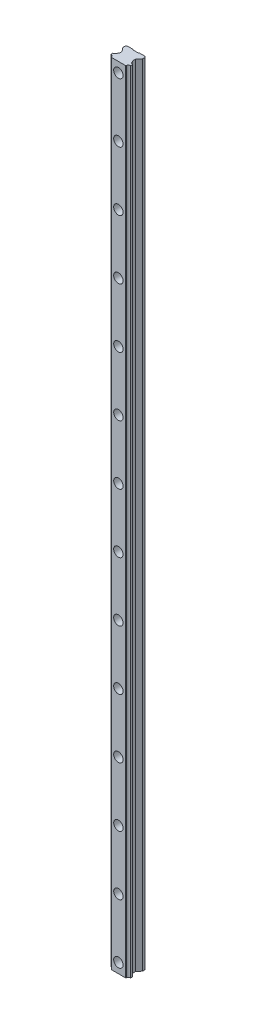
from build123d import *

# Parameters (mm, degrees)
SKIZZE1_W                       = 20
SKIZZE1_H                       = 800
AUFSATZ_LINEAR_AUSTRAGEN1_DEPTH = 18
SKIZZE2_W                       = 5
SKIZZE2_H                       = 0.5
SCHNITT_LINEAR_AUSTRAGEN1_DEPTH = 801.264956124
SCHNITT_LINEAR_AUSTRAGEN2_DEPTH = 801.264956124
SCHNITT_LINEAR_AUSTRAGEN3_DEPTH = 801.264956124
FORMSCHR_GE1_ANGLE              = 50.906141114
FORMSCHR_GE2_ANGLE              = 50.906141114
FORMSCHR_GE3_ANGLE              = 45
F_5_0_5_DURCHMESSER_BOHRUNG1_D  = 5
F_5_0_5_DURCHMESSER_BOHRUNG2_D  = 5
BOHRUNG1_D                      = 6
BOHRUNG1_DEPTH                  = 18
BOHRUNG1_CBORE_D                = 9.5
BOHRUNG1_CBORE_DEPTH            = 8.5
FASE1_SIZE                      = 1
FASE2_SIZE                      = 0.448979592


with BuildPart() as part:
    # Skizze1 → Aufsatz-Linear austragen1 (new body)
    with BuildSketch(Plane(origin=(0, 0, 0), x_dir=(-1, 0, 0), z_dir=(0, 0, -1))):
        with Locations((0, 400)):
            Rectangle(SKIZZE1_W, SKIZZE1_H)
    extrude(amount=-AUFSATZ_LINEAR_AUSTRAGEN1_DEPTH)

    # Skizze2 → Schnitt-Linear austragen1 (cut, through all)
    with BuildSketch(Plane.XZ):
        with Locations((0, 0.25)):
            Rectangle(SKIZZE2_W, SKIZZE2_H)
    extrude(amount=-SCHNITT_LINEAR_AUSTRAGEN1_DEPTH, mode=Mode.SUBTRACT)

    # Skizze3 → Schnitt-Linear austragen2 (cut, through all)
    with BuildSketch(Plane.XZ):
        with BuildLine():
            Line((-10, 13.5), (-10, 7.5))
            Line((-10, 7.5), (-6.75, 7.5))
            Line((-6.75, 7.5), (-6.75, 10.5))
            Line((-6.75, 10.5), (-7.5, 11.109375))
            ThreePointArc((-7.5, 11.109375), (-8.270470592, 12.806156162), (-10, 13.5))
        make_face()
    extrude(amount=-SCHNITT_LINEAR_AUSTRAGEN2_DEPTH, mode=Mode.SUBTRACT)

    # Skizze4 → Schnitt-Linear austragen3 (cut, through all)
    with BuildSketch(Plane.XZ):
        with BuildLine():
            Line((7.5, 11.109375), (6.75, 10.5))
            Line((6.75, 10.5), (6.75, 3.5))
            Line((6.75, 3.5), (10, 3.5))
            Line((10, 3.5), (10, 13.5))
            ThreePointArc((10, 13.5), (8.270470592, 12.806156162), (7.5, 11.109375))
        make_face()
    extrude(amount=-SCHNITT_LINEAR_AUSTRAGEN3_DEPTH, mode=Mode.SUBTRACT)

    # Formschräge1
    formschr_ge1_faces = [part.faces().sort_by_distance(p)[0] for p in [
        (8.375, 400, 3.5),
    ]]
    draft(formschr_ge1_faces, Plane(origin=(10, 800, 18), x_dir=(0, 0, 1), z_dir=(1, 0, 0)), FORMSCHR_GE1_ANGLE)

    # Formschräge2
    formschr_ge2_faces = [part.faces().sort_by_distance(p)[0] for p in [
        (-8.375, 400, 7.5),
    ]]
    draft(formschr_ge2_faces, Plane(origin=(-6.75, 800, 7.5), x_dir=(0, 0, -1), z_dir=(-1, 0, 0)), FORMSCHR_GE2_ANGLE)

    # Formschräge3
    formschr_ge3_faces = [part.faces().sort_by_distance(p)[0] for p in [
        (2.5, 400, 0.25),
        (-2.5, 400, 0.25),
    ]]
    draft(formschr_ge3_faces, Plane(origin=(2.5, 800, 0.5), x_dir=(-1, 0, 0), z_dir=(0, 0, -1)), FORMSCHR_GE3_ANGLE)

    # Ø5.0 (5) Durchmesser Bohrung1 (through all)
    with Locations(Plane(origin=(0, 800, 0), x_dir=(1, 0, 0), z_dir=(0, 1, 0))):
        with Locations((10, -18)):
            Hole(F_5_0_5_DURCHMESSER_BOHRUNG1_D / 2)

    # Ø5.0 (5) Durchmesser Bohrung2 (through all)
    with Locations(Plane(origin=(0, 0, 0), x_dir=(-1, 0, 0), z_dir=(0, -1, 0))):
        with Locations((10, -18)):
            Hole(F_5_0_5_DURCHMESSER_BOHRUNG2_D / 2)

    # Bohrung1
    with Locations(Plane.XY.offset(18)):
        with Locations((0, 790), (0, 730), (0, 670), (0, 610), (0, 550), (0, 490), (0, 430), (0, 370), (0, 310), (0, 250), (0, 190), (0, 130), (0, 70), (0, 10)):
            CounterBoreHole(BOHRUNG1_D / 2, BOHRUNG1_CBORE_D / 2, BOHRUNG1_CBORE_DEPTH, depth=BOHRUNG1_DEPTH)

    # Fase1
    fase1_edges = [part.edges().sort_by_distance(p)[0] for p in [
        (-10, 400, 0),
        (10, 400, 0),
    ]]
    chamfer(fase1_edges, length=FASE1_SIZE)

    # Fase2
    # the kernel refuses this chamfer: 0.448979592, 0.406117321 mm, written as the material it takes off along each edge
    with BuildSketch(Plane(origin=(7.5, 801.156138571, 18), x_dir=(0.08868753028202897, 0, -0.9960594972050988), z_dir=(0, -1, 0))) as fase2_piece_1:
        with BuildLine():
            Line((0.443437651, 0), (-FASE2_SIZE * 0.0886875302498, -FASE2_SIZE * 0.996059496843))
            Line((-FASE2_SIZE * 0.0886875302498, -FASE2_SIZE * 0.996059496843), (0, 0))
            ThreePointArc((0, 0), (0.228351687, -0.009842458), (0.443437651, 0))
        make_face()
    extrude(amount=802.312277141, mode=Mode.SUBTRACT)
    with BuildSketch(Plane(origin=(-7.5, -1.156138571, 18), x_dir=(1, 0, 0), z_dir=(0, 1, 0))) as fase2_piece_2:
        with BuildLine():
            Line((FASE2_SIZE, 0), (-0.03932739, 0.441690284))
            ThreePointArc((-0.03932739, 0.441690284), (-0.010448273, 0.22832477), (0, 0))
            Line((0, 0), (FASE2_SIZE, 0))
        make_face()
    extrude(amount=802.312277141, mode=Mode.SUBTRACT)


solid = part.part
